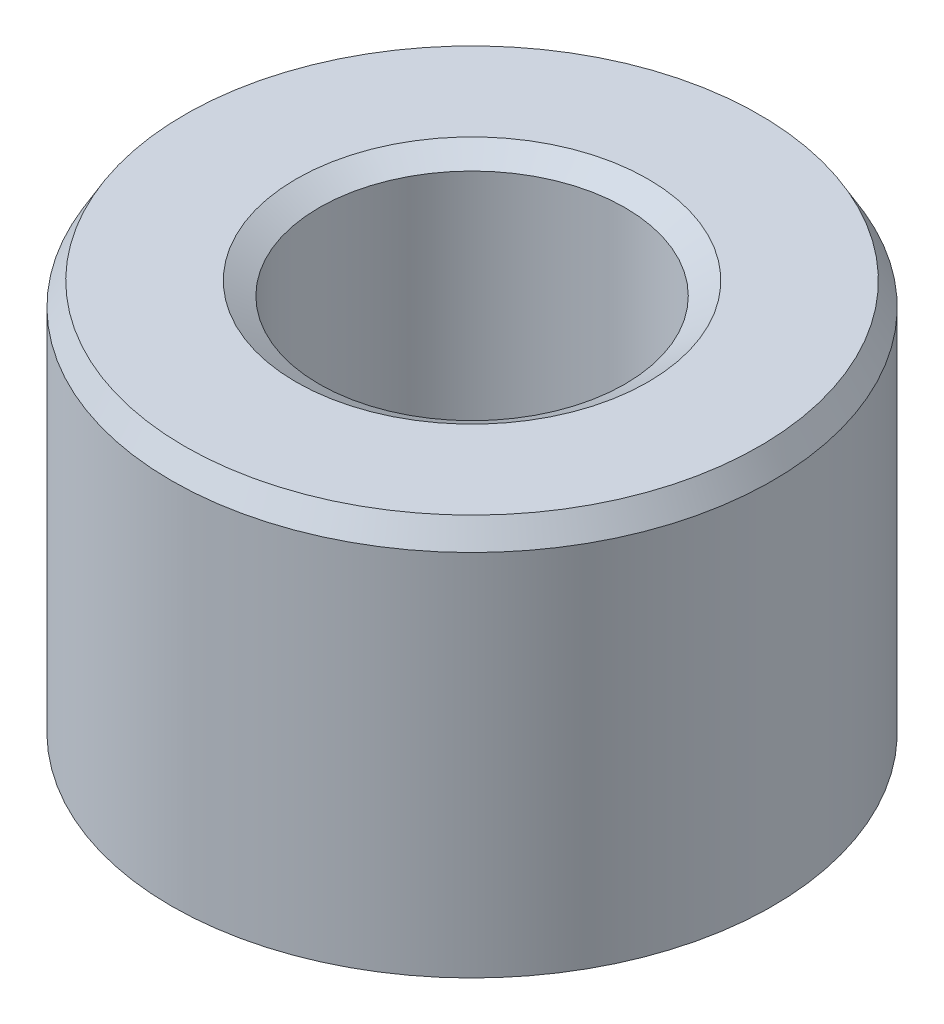
from build123d import *
from OCP.BRepFilletAPI import BRepFilletAPI_MakeChamfer

# Parameters (mm, degrees)
SKETCH1_R           = 45
BOSS_EXTRUDE1_DEPTH = 60.58795125
SKETCH2_R           = 22.888956287
CUT_EXTRUDE1_DEPTH  = 88.868651046
CHAMFER1_SIZE       = 3.444248562
CHAMFER1_SIZE2      = 1.988537834


with BuildPart() as part:
    # Sketch1 → Boss-Extrude1 (new body)
    with BuildSketch(Plane(origin=(0, 0, 0), x_dir=(1, 0, 0), z_dir=(0, 1, 0))):
        Circle(SKETCH1_R)
    extrude(amount=BOSS_EXTRUDE1_DEPTH)

    # Sketch2 → Cut-Extrude1 (cut, through all)
    with BuildSketch(Plane(origin=(0, 0, 0), x_dir=(1, 0, 0), z_dir=(0, 1, 0))):
        Circle(SKETCH2_R)
    extrude(amount=CUT_EXTRUDE1_DEPTH, mode=Mode.SUBTRACT)

    # Chamfer1: one chamfer whose edges measure the first distance from different faces: ONE call of the kernel's chamfer builder (chamfer() names one face for all edges)
    chamfer1_edges_1 = [part.edges().sort_by_distance(p)[0] for p in [
        (-22.888956287, 60.58795125, 0),
    ]]
    chamfer1_side_1 = [part.faces().sort_by_distance(p)[0] for p in [
        (-43.727207794, 60.58795125, 0),
    ]]
    chamfer1_edges_2 = [part.edges().sort_by_distance(p)[0] for p in [
        (-22.888956287, 0, 0),
    ]]
    chamfer1_side_2 = [part.faces().sort_by_distance(p)[0] for p in [
        (-22.888956287, 30.293975625, 0),
    ]]
    chamfer1_edges_3 = [part.edges().sort_by_distance(p)[0] for p in [
        (-45, 0, 0),
    ]]
    chamfer1_side_3 = [part.faces().sort_by_distance(p)[0] for p in [
        (-43.727207794, 0, 0),
    ]]
    chamfer1_edges_4 = [part.edges().sort_by_distance(p)[0] for p in [
        (-45, 60.58795125, 0),
    ]]
    chamfer1_side_4 = [part.faces().sort_by_distance(p)[0] for p in [
        (-45, 30.293975625, 0),
    ]]
    chamfer1 = BRepFilletAPI_MakeChamfer(part.part.solid().wrapped)
    for e in chamfer1_edges_1:
        chamfer1.Add(CHAMFER1_SIZE, CHAMFER1_SIZE2, e.wrapped, chamfer1_side_1[0].wrapped)  # the first distance lies on this face
    for e in chamfer1_edges_2:
        chamfer1.Add(CHAMFER1_SIZE, CHAMFER1_SIZE2, e.wrapped, chamfer1_side_2[0].wrapped)  # the first distance lies on this face
    for e in chamfer1_edges_3:
        chamfer1.Add(CHAMFER1_SIZE, CHAMFER1_SIZE2, e.wrapped, chamfer1_side_3[0].wrapped)  # the first distance lies on this face
    for e in chamfer1_edges_4:
        chamfer1.Add(CHAMFER1_SIZE, CHAMFER1_SIZE2, e.wrapped, chamfer1_side_4[0].wrapped)  # the first distance lies on this face
    add(Compound.cast(chamfer1.Shape()), mode=Mode.REPLACE)


solid = part.part
